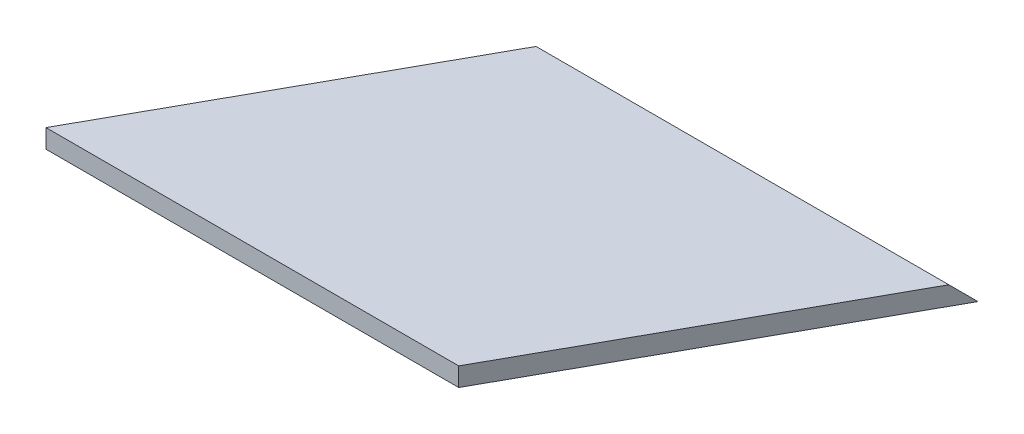
from build123d import *

# Parameters (mm, degrees)
BOSS_EXTRUDE1_DEPTH = 0.5
CHAMFER1_SIZE       = 0.5


with BuildPart() as part:
    # Sketch1 → Boss-Extrude1 (new body)
    with BuildSketch(Plane(origin=(0, 0, 0), x_dir=(1, 0, 0), z_dir=(0, 1, 0))):
        Polygon((-78.095165617, -29.786632), (-83.030527551, -38.690260619), (-72.030527551, -38.690260619), (-67.095165617, -29.786632), align=None)
    extrude(amount=BOSS_EXTRUDE1_DEPTH)

    # Chamfer1
    chamfer1_edges = [part.edges().sort_by_distance(p)[0] for p in [
        (-72.595165617, 0.5, 29.786632),
    ]]
    chamfer(chamfer1_edges, length=CHAMFER1_SIZE - 0.0001)  # a hair under: the kernel refuses the full size


solid = part.part
